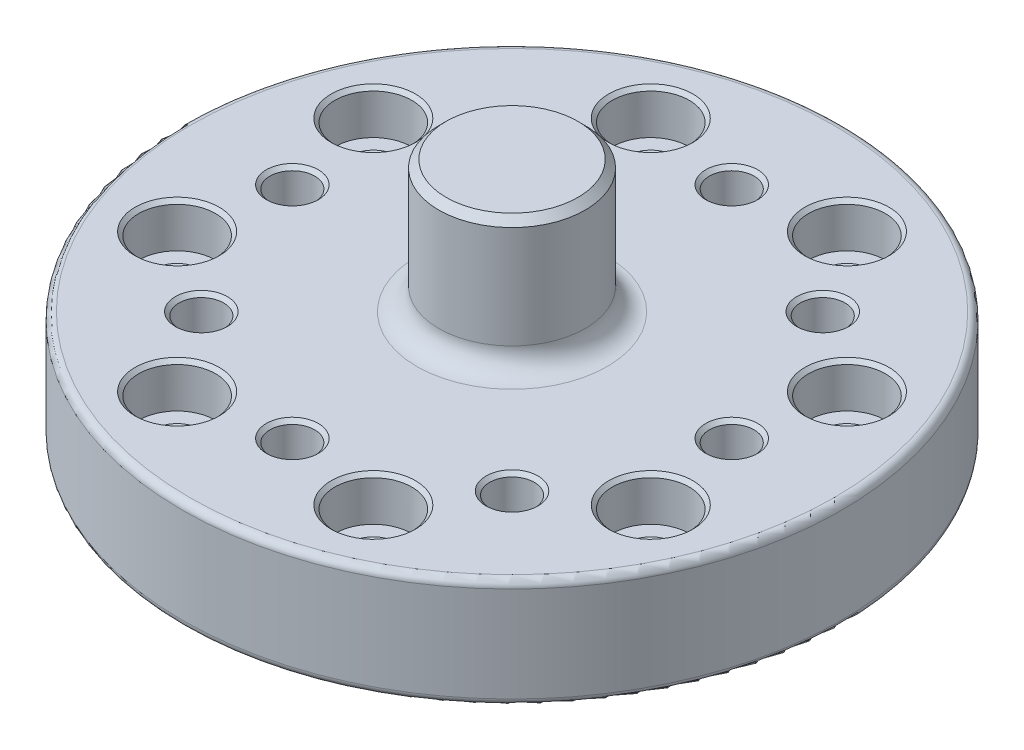
from build123d import *

# Parameters (mm, degrees)
SKETCH1_R                    = 45
BOSS_EXTRUDE1_DEPTH          = 15
SKETCH2_R                    = 3.05
CUT_EXTRUDE1_DEPTH           = 66.383484153
CIRPATTERN1_COUNT            = 8
SKETCH3_R                    = 10
BOSS_EXTRUDE2_DEPTH          = 18
FILLET1_R                    = 3
FILLET2_R                    = 1
CHAMFER1_SIZE                = 0.5
SKETCH4_R                    = 2.65
CUT_EXTRUDE2_DEPTH           = 67.136223123
SKETCH5_R                    = 5.25
CUT_EXTRUDE3_DEPTH           = 6
CHAMFER2_SIZE                = 0.5
CIRPATTERN2_COUNT            = 8
CHAMFER2_OF_CIRPATTERN2_SIZE = 0.5
CHAMFER3_SIZE                = 1


with BuildPart() as part:
    # Sketch1 → Boss-Extrude1 (new body)
    with BuildSketch(Plane(origin=(0, 0, 0), x_dir=(1, 0, 0), z_dir=(0, 1, 0))):
        Circle(SKETCH1_R)
    extrude(amount=BOSS_EXTRUDE1_DEPTH)

    # Sketch2 → Cut-Extrude1 (cut, through all)
    with BuildSketch(Plane(origin=(0, 15, 0), x_dir=(1, 0, 0), z_dir=(0, 1, 0))):
        with Locations((-30, 0)):
            Circle(SKETCH2_R)
    cut_extrude1 = extrude(amount=-CUT_EXTRUDE1_DEPTH, mode=Mode.SUBTRACT)

    # CirPattern1: Cut-Extrude1 ×8 about axis
    cirpattern1_axis = Axis((0, 15, 0), (0, 1, 0))
    for i in range(1, CIRPATTERN1_COUNT):
        add(cut_extrude1.rotate(cirpattern1_axis, i * 360 / CIRPATTERN1_COUNT), mode=Mode.SUBTRACT)

    # Sketch3 → Boss-Extrude2 (add)
    with BuildSketch(Plane(origin=(0, 15, 0), x_dir=(1, 0, 0), z_dir=(0, 1, 0))):
        Circle(SKETCH3_R)
    extrude(amount=BOSS_EXTRUDE2_DEPTH)

    # Fillet1
    fillet1_edges = [part.edges().sort_by_distance(p)[0] for p in [
        (-10, 15, 0),
    ]]
    fillet(fillet1_edges, radius=FILLET1_R)

    # Fillet2
    fillet2_edges = [part.edges().sort_by_distance(p)[0] for p in [
        (-45, 0, 0),
        (-45, 15, 0),
    ]]
    fillet(fillet2_edges, radius=FILLET2_R)

    # Chamfer1
    chamfer1_edges = [part.edges().sort_by_distance(p)[0] for p in [
        (0, 0, 33.05),
        (23.369879118, 0, 23.369879118),
        (33.05, 0, 0),
        (23.369879118, 0, -23.369879118),
        (0, 0, -33.05),
        (-23.369879118, 0, -23.369879118),
        (-33.05, 0, 0),
        (-23.369879118, 0, 23.369879118),
        (-23.369879118, 15, -23.369879118),
        (0, 15, -33.05),
        (23.369879118, 15, -23.369879118),
        (33.05, 15, 0),
        (23.369879118, 15, 23.369879118),
        (0, 15, 33.05),
        (-33.05, 15, 0),
        (-23.369879118, 15, 23.369879118),
    ]]
    chamfer(chamfer1_edges, length=CHAMFER1_SIZE)

    # Sketch4 → Cut-Extrude2 (cut, through all)
    with BuildSketch(Plane(origin=(0, 15, 0), x_dir=(1, 0, 0), z_dir=(0, 1, 0))):
        with Locations((-32.335783638, 13.393920133)):
            Circle(SKETCH4_R)
    cut_extrude2 = extrude(amount=-CUT_EXTRUDE2_DEPTH, mode=Mode.SUBTRACT)

    # Sketch5 → Cut-Extrude3 (cut)
    with BuildSketch(Plane(origin=(0, 15, 0), x_dir=(1, 0, 0), z_dir=(0, 1, 0))):
        with Locations((-32.335783638, 13.393920133)):
            Circle(SKETCH5_R)
    cut_extrude3 = extrude(amount=-CUT_EXTRUDE3_DEPTH, mode=Mode.SUBTRACT)

    # Chamfer2
    chamfer2_edges = [part.edges().sort_by_distance(p)[0] for p in [
        (-34.985783638, 0, -13.393920133),
        (-37.585783638, 15, -13.393920133),
        (-34.985783638, 9, -13.393920133),
    ]]
    chamfer(chamfer2_edges, length=CHAMFER2_SIZE)

    # CirPattern2: Cut-Extrude2, Cut-Extrude3 ×8 about axis
    cirpattern2_axis = Axis((0, 15, 0), (0, 1, 0))
    add([cut_extrude2.rotate(cirpattern2_axis, i * 360 / CIRPATTERN2_COUNT) for i in range(1, CIRPATTERN2_COUNT)], mode=Mode.SUBTRACT)
    add([cut_extrude3.rotate(cirpattern2_axis, i * 360 / CIRPATTERN2_COUNT) for i in range(1, CIRPATTERN2_COUNT)], mode=Mode.SUBTRACT)

    # Chamfer2 of CirPattern2
    chamfer2_of_cirpattern2_edges = [part.edges().sort_by_distance(p)[0] for p in [
        (-34.209616608, 0, 15.267753103),
        (-36.048094239, 15, 17.106230734),
        (-34.209616608, 9, 15.267753103),
        (-13.393920133, 0, 34.985783638),
        (-13.393920133, 15, 37.585783638),
        (-13.393920133, 9, 34.985783638),
        (15.267753103, 0, 34.209616608),
        (17.106230734, 15, 36.048094239),
        (15.267753103, 9, 34.209616608),
        (34.985783638, 0, 13.393920133),
        (37.585783638, 15, 13.393920133),
        (34.985783638, 9, 13.393920133),
        (34.209616608, 0, -15.267753103),
        (36.048094239, 15, -17.106230734),
        (34.209616608, 9, -15.267753103),
        (13.393920133, 0, -34.985783638),
        (13.393920133, 15, -37.585783638),
        (13.393920133, 9, -34.985783638),
        (-15.267753103, 0, -34.209616608),
        (-17.106230734, 15, -36.048094239),
        (-15.267753103, 9, -34.209616608),
    ]]
    chamfer(chamfer2_of_cirpattern2_edges, length=CHAMFER2_OF_CIRPATTERN2_SIZE)

    # Chamfer3
    chamfer3_edges = [part.edges().sort_by_distance(p)[0] for p in [
        (-10, 33, 0),
    ]]
    chamfer(chamfer3_edges, length=CHAMFER3_SIZE)


solid = part.part
